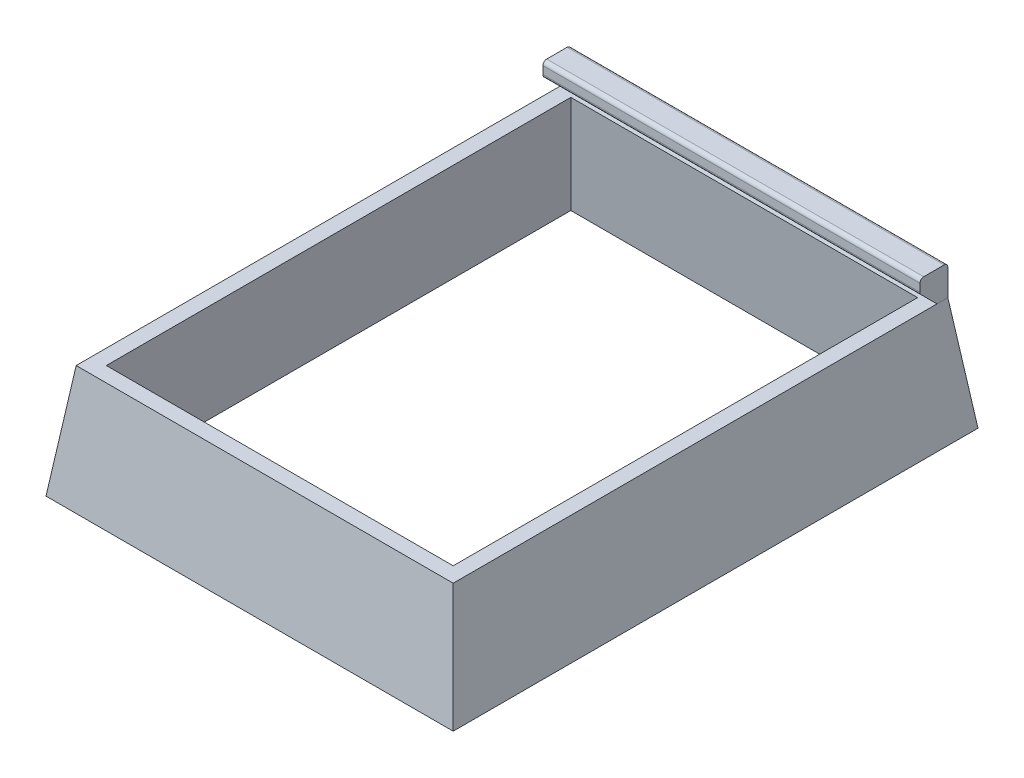
from build123d import *

# Parameters (mm, degrees)
BOSS_EXTRUDE1_DEPTH = 20
LOFT1_START         = -34.8
LOFT1_DEPTH         = 69.6
LOFT1_START_2       = -28
LOFT1_2_DEPTH       = 56
BOSS_EXTRUDE2_START = -2
BOSS_EXTRUDE2_DEPTH = 50
BOSS_EXTRUDE3_DEPTH = 2.3
BOSS_EXTRUDE4_DEPTH = 2.3
CUT_EXTRUDE1_START  = -69.6
SKETCH7_R           = 5.3
CUT_EXTRUDE1_DEPTH  = 2
CUT_EXTRUDE2_DEPTH  = 70
SKETCH9_W           = 56.388818991
SKETCH9_H           = 73.181727467
BOSS_EXTRUDE5_DEPTH = 48


with BuildPart() as part:
    # Sketch1 → Boss-Extrude1 (new body)
    with BuildSketch(Plane(origin=(0, 0, 0), x_dir=(1, 0, 0), z_dir=(0, 1, 0))):
        Polygon((27, 34.8), (-27, 34.8), (-27, 0), (-27, -34.8), (27, -34.8), (27, 0), align=None)
        Polygon((25, 0), (25, 32.8), (-25, 32.8), (-25, 0), (-25, -32.8), (25, -32.8), align=None, mode=Mode.SUBTRACT)
    extrude(amount=BOSS_EXTRUDE1_DEPTH)

    # Loft1: read off the stored shape, not the designer's step
    # Loft1 outline → Loft1 (add)
    with BuildSketch(Plane.XY.offset(LOFT1_START)):
        Polygon((-27, 20), (27, 20), (25, 35), (-25, 35), align=None)
    extrude(amount=LOFT1_DEPTH)

    # Loft1 2 outline → Loft1 2 (cut)
    with BuildSketch(Plane.YZ.offset(LOFT1_START_2)):
        Polygon((20, 34.8), (35, 32.8), (35, 34.8), align=None)
        Polygon((35, -32.8), (20, -34.8), (35, -34.8), align=None)
    extrude(amount=LOFT1_2_DEPTH, mode=Mode.SUBTRACT)

    # Cut-Loft1: read off the stored shape, not the designer's step
    # Cut-Loft1: loft between two sections, ruled curve by curve
    cut_loft1_from = [
        Edge.make_line((-25, 20, 32.8), (-25, 20, -32.8)),
        Edge.make_line((-25, 20, -32.8), (25, 20, -32.8)),
        Edge.make_line((25, 20, 32.8), (-25, 20, 32.8)),
        Edge.make_line((25, 20, -32.8), (25, 20, 32.8)),
    ]
    cut_loft1_to = [
        Edge.make_line((-23, 35, 30.8), (-23, 35, -30.8)),
        Edge.make_line((-23, 35, -30.8), (23, 35, -30.8)),
        Edge.make_line((23, 35, 30.8), (-23, 35, 30.8)),
        Edge.make_line((23, 35, -30.8), (23, 35, 30.8)),
    ]
    cut_loft1 = Solid(Shell([*[Face.make_surface_from_curves(cut_loft1_from[k], cut_loft1_to[k]) for k in range(4)], Face(Wire(cut_loft1_from)), Face(Wire(cut_loft1_to))]))
    add(cut_loft1, mode=Mode.SUBTRACT)

    # Sketch2 → Boss-Extrude2 (add)
    with BuildSketch(Plane(origin=(27, 0, 0), x_dir=(0, 0, -1), z_dir=(1, 0, 0)).offset(BOSS_EXTRUDE2_START)):
        with BuildLine():
            Line((32.8, 35), (32.8, 38.5))
            ThreePointArc((32.8, 38.5), (32.653553391, 38.853553391), (32.3, 39))
            Line((32.3, 39), (29.6, 39))
            ThreePointArc((29.6, 39), (29.246446609, 38.853553391), (29.1, 38.5))
            Line((29.1, 38.5), (29.1, 37.468550682))
            ThreePointArc((29.1, 37.468550682), (29.138060234, 37.277208966), (29.246446609, 37.114997291))
            Line((29.246446609, 37.114997291), (31.361443901, 35))
            Line((31.361443901, 35), (32.8, 35))
        make_face()
    extrude(amount=-BOSS_EXTRUDE2_DEPTH)

    # Sketch7 → Cut-Extrude1 (cut)
    with BuildSketch(Plane.XY.offset(34.8).offset(CUT_EXTRUDE1_START)):
        with Locations((0, 10)):
            Circle(SKETCH7_R)
    extrude(amount=CUT_EXTRUDE1_DEPTH, mode=Mode.SUBTRACT)

    # Sketch8 → Cut-Extrude2 (cut)
    with BuildSketch(Plane.ZY.offset(27)):
        with BuildLine():
            Line((-25.8, 6), (-22.8, 6))
            ThreePointArc((-22.8, 6), (-21.8, 4), (-22.8, 2))
            Line((-22.8, 2), (-25.8, 2))
            ThreePointArc((-25.8, 2), (-26.8, 4), (-25.8, 6))
        make_face()
        with BuildLine():
            Line((22.8, 6), (25.8, 6))
            ThreePointArc((25.8, 6), (26.8, 4), (25.8, 2))
            Line((25.8, 2), (22.8, 2))
            ThreePointArc((22.8, 2), (21.8, 4), (22.8, 6))
        make_face()
    extrude(amount=-CUT_EXTRUDE2_DEPTH, mode=Mode.SUBTRACT)


with BuildPart() as body_2:
    # Sketch5 → Boss-Extrude3 (new body)
    with BuildSketch(Plane.XZ):
        with BuildLine():
            Line((-25, -34.8), (-25, -9.8))
            ThreePointArc((-25, -9.8), (0, 15.2), (25, -9.8))
            Line((25, -9.8), (25, -34.8))
            Line((25, -34.8), (27, -34.8))
            Line((27, -34.8), (27, 34.8))
            Line((27, 34.8), (-27, 34.8))
            Line((-27, 34.8), (-27, -34.8))
            Line((-27, -34.8), (-25, -34.8))
        make_face()
    extrude(amount=BOSS_EXTRUDE3_DEPTH)

    # Sketch6 → Boss-Extrude4 (add)
    with BuildSketch(Plane.XZ.offset(2.3)):
        with BuildLine():
            Line((22.7, -34.8), (27, -34.8))
            Line((27, -34.8), (27, 34.8))
            Line((27, 34.8), (-27, 34.8))
            Line((-27, 34.8), (-27, -34.8))
            Line((-27, -34.8), (-22.7, -34.8))
            Line((-22.7, -34.8), (-22.7, -9.8))
            ThreePointArc((-22.7, -9.8), (0, 12.9), (22.7, -9.8))
            Line((22.7, -9.8), (22.7, -34.8))
        make_face()
    extrude(amount=BOSS_EXTRUDE4_DEPTH)


with BuildPart() as body_2_2:
    # Sketch9 → Boss-Extrude5 (new body)
    with BuildSketch(Plane(origin=(0, 20, 0), x_dir=(-1, 0, 0), z_dir=(0, 1, 0))):
        with Locations((0.397726779, 0.176767457)):
            Rectangle(SKETCH9_W, SKETCH9_H)
    extrude(amount=-BOSS_EXTRUDE5_DEPTH)


with BuildPart() as part_1:
    add(part.part)

    # Combine1: cut body 2 2
    add(body_2_2.part, mode=Mode.SUBTRACT)


solid = part_1.part
